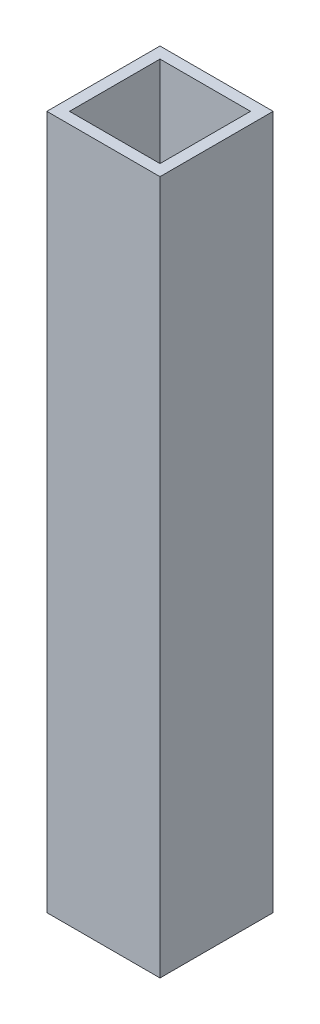
from build123d import *

# Parameters (mm, degrees)
SKETCH1_W           = 15
SKETCH1_H           = 15
SKETCH1_W_2         = 12
SKETCH1_H_2         = 12
EXTRUDE_THIN1_DEPTH = 92


with BuildPart() as part:
    # Sketch1 → Extrude-Thin1 (new body)
    with BuildSketch(Plane(origin=(0, 0, 0), x_dir=(1, 0, 0), z_dir=(0, 1, 0))):
        with Locations((7.5, 7.5)):
            Rectangle(SKETCH1_W, SKETCH1_H)
        with Locations((7.5, 7.5)):
            Rectangle(SKETCH1_W_2, SKETCH1_H_2, mode=Mode.SUBTRACT)
    extrude(amount=EXTRUDE_THIN1_DEPTH)


solid = part.part
